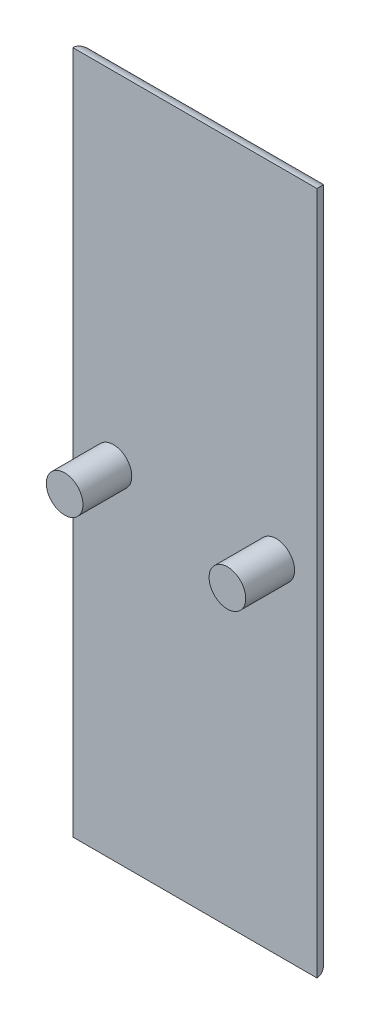
from build123d import *

# Parameters (mm, degrees)
SKETCH1_W           = 30
SKETCH1_H           = 84
SKETCH1_R           = 2.25
BOSS_EXTRUDE1_DEPTH = 2
SKETCH1_4_R         = 2.25
BOSS_EXTRUDE2_DEPTH = 8
FILLET1_R           = 2


with BuildPart() as part:
    # Sketch1 → Boss-Extrude1 (new body)
    with BuildSketch(Plane.XY):
        Rectangle(SKETCH1_W, SKETCH1_H)
        with Locations((-10, 0)):
            Circle(SKETCH1_R, mode=Mode.SUBTRACT)
        with Locations(Location((10, 0, 0), (0, 0, 180))):
            Circle(SKETCH1_R, mode=Mode.SUBTRACT)
    extrude(amount=BOSS_EXTRUDE1_DEPTH)

    # Sketch1<4> → Boss-Extrude2 (add)
    with BuildSketch(Plane.XY):
        with Locations((-10, 0)):
            Circle(SKETCH1_4_R)
        with Locations(Location((10, 0, 0), (0, 0, 180))):
            Circle(SKETCH1_4_R)
    extrude(amount=BOSS_EXTRUDE2_DEPTH)

    # Fillet1
    fillet1_edges = [part.edges().sort_by_distance(p)[0] for p in [
        (0, 42, 0),
        (-15, 0, 0),
        (0, -42, 0),
        (15, 0, 0),
    ]]
    fillet(fillet1_edges, radius=FILLET1_R - 0.0001)  # a hair under: the kernel refuses the full size


solid = part.part
